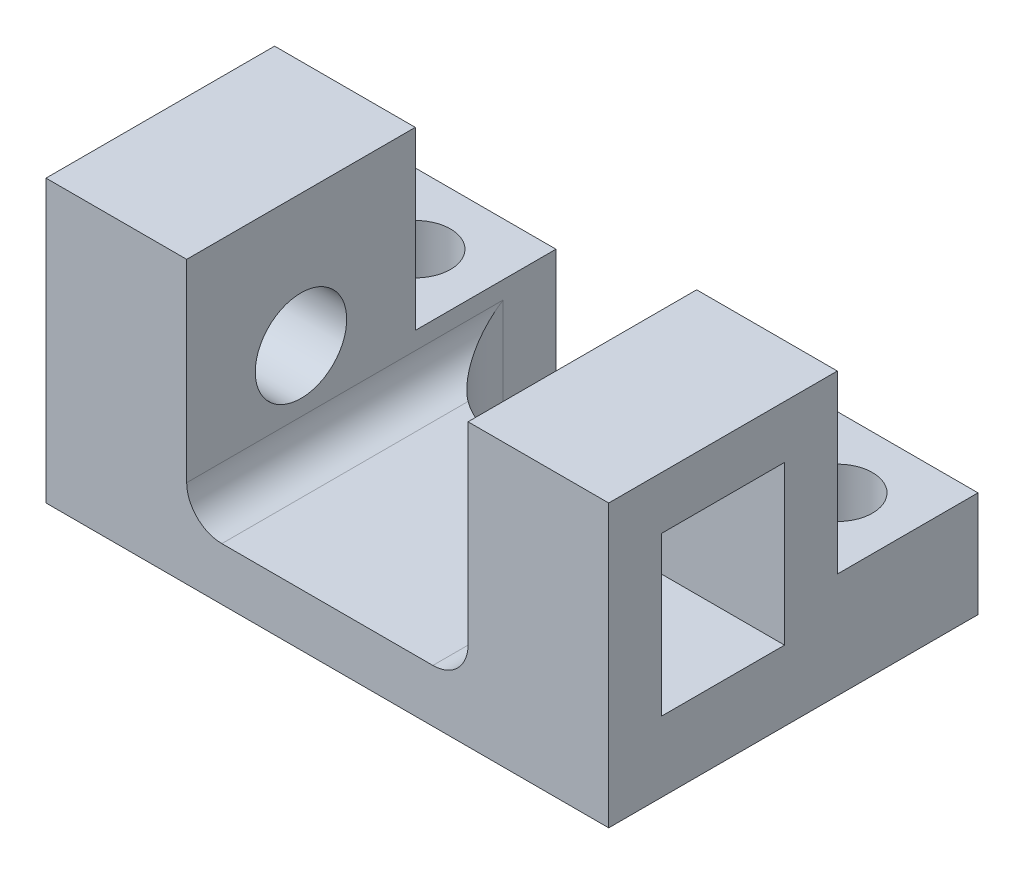
from build123d import *

# Parameters (mm, degrees)
SKETCH1_W                  = 16
SKETCH1_H                  = 6.5
BOSS_EXTRUDE1_DEPTH        = 4
SKETCH2_W                  = 8
SKETCH2_H                  = 6.5
CUT_EXTRUDE1_DEPTH         = 6.5
SKETCH10_W                 = 4
SKETCH10_H                 = 4
BOSS_EXTRUDE2_DEPTH        = 3
M1_6_CLEARANCE_HOLE1_D     = 2
M1_6_CLEARANCE_HOLE1_DEPTH = 4
M1_6_CLEARANCE_HOLE1_TIP   = 0.600860619
FILLET1_R                  = 1
FILLET2_R                  = 2.5
SKETCH14_W                 = 3.5
SKETCH14_H                 = 4.5
CUT_EXTRUDE3_DEPTH         = 5
M2_CLEARANCE_HOLE3_D       = 2.6
M2_CLEARANCE_HOLE3_DEPTH   = 4
M2_CLEARANCE_HOLE3_TIP     = 0.781118805


with BuildPart() as part:
    # Sketch1 → Boss-Extrude1 (new, symmetric)
    with BuildSketch(Plane(origin=(0, 0, 0), x_dir=(1, 0, 0), z_dir=(0, 1, 0))):
        Rectangle(SKETCH1_W, SKETCH1_H)
    extrude(amount=BOSS_EXTRUDE1_DEPTH, both=True)

    # Sketch2 → Cut-Extrude1 (cut)
    with BuildSketch(Plane(origin=(0, 4, 5), x_dir=(1, 0, 0), z_dir=(0, -1, 0))):
        with Locations((0, -5)):
            Rectangle(SKETCH2_W, SKETCH2_H)
    extrude(amount=CUT_EXTRUDE1_DEPTH, mode=Mode.SUBTRACT)

    # Sketch10 → Boss-Extrude2 (add)
    with BuildSketch(Plane.XZ.offset(4)):
        with Locations((6, -5.25)):
            Rectangle(SKETCH10_W, SKETCH10_H)
        with Locations((-6, -5.25)):
            Rectangle(SKETCH10_W, SKETCH10_H)
    extrude(amount=-BOSS_EXTRUDE2_DEPTH)

    # M1.6 Clearance Hole1
    with Locations(Plane(origin=(0, -1, 0), x_dir=(1, 0, 0), z_dir=(0, 1, 0))):
        with Locations((6, 5.25), (-6, 5.25)):
            Hole(M1_6_CLEARANCE_HOLE1_D / 2, depth=M1_6_CLEARANCE_HOLE1_DEPTH)
            with Locations((0, 0, -(M1_6_CLEARANCE_HOLE1_DEPTH + M1_6_CLEARANCE_HOLE1_TIP / 2))):  # 118° drill point
                Cone(0, M1_6_CLEARANCE_HOLE1_D / 2, M1_6_CLEARANCE_HOLE1_TIP, mode=Mode.SUBTRACT)

    # Fillet1
    fillet1_edges = [part.edges().sort_by_distance(p)[0] for p in [
        (-4, -2.5, 0),
        (4, -2.5, 0),
    ]]
    fillet(fillet1_edges, radius=FILLET1_R)

    # Fillet2
    fillet2_edges = [part.edges().sort_by_distance(p)[0] for p in [
        (-4, -2.75, -3.25),
        (4, -2.75, -3.25),
    ]]
    fillet(fillet2_edges, radius=FILLET2_R)

    # Sketch14 → Cut-Extrude3 (cut)
    with BuildSketch(Plane(origin=(8, 0, 0), x_dir=(0, 0, -1), z_dir=(1, 0, 0))):
        with Locations((0, 0.25)):
            Rectangle(SKETCH14_W, SKETCH14_H)
    extrude(amount=-CUT_EXTRUDE3_DEPTH, mode=Mode.SUBTRACT)

    # M2 Clearance Hole3
    with Locations(Plane.ZY.offset(8)):
        with Locations((0, 0.25)):
            Hole(M2_CLEARANCE_HOLE3_D / 2, depth=M2_CLEARANCE_HOLE3_DEPTH)
            with Locations((0, 0, -(M2_CLEARANCE_HOLE3_DEPTH + M2_CLEARANCE_HOLE3_TIP / 2))):  # 118° drill point
                Cone(0, M2_CLEARANCE_HOLE3_D / 2, M2_CLEARANCE_HOLE3_TIP, mode=Mode.SUBTRACT)


solid = part.part
